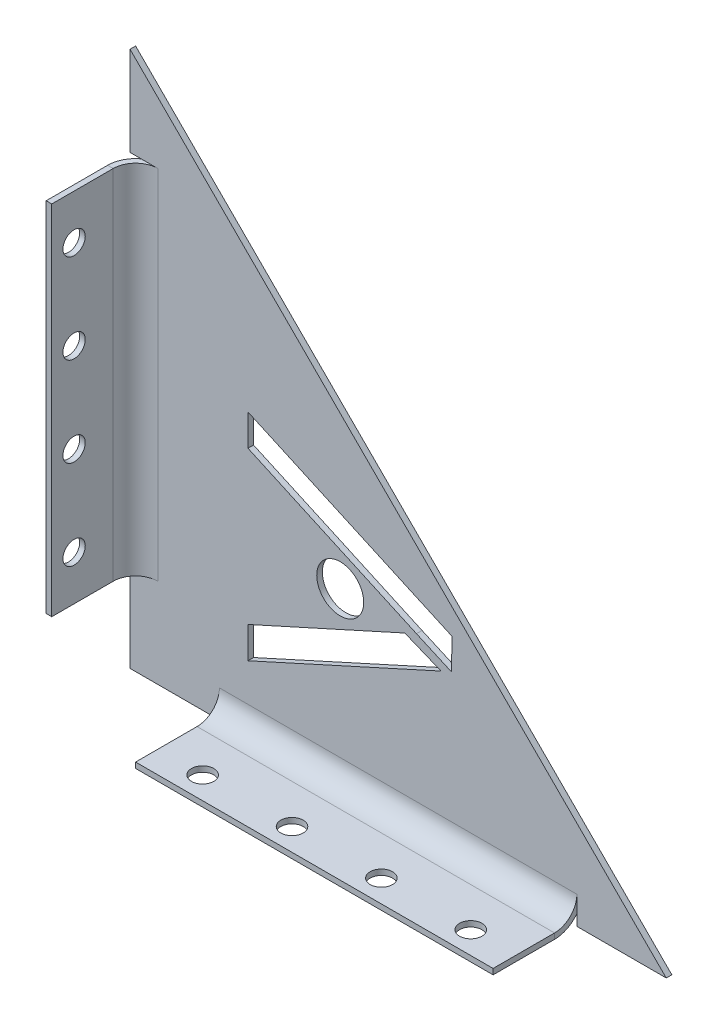
from build123d import *

# Parameters (mm, degrees)
BOSS_EXTRUDE1_DEPTH          = 1.5875
SKETCH7_W                    = 1.5875
SKETCH7_H                    = 101.6
BOSS_EXTRUDE2_DEPTH          = 0.0254
EDGE_FLANGE1_STRIP_W         = 19.05
EDGE_FLANGE1_STRIP_H         = 1.5875
EDGE_FLANGE1_STRIP_CUT_DEPTH = 101.6
EDGE_FLANGE1_DEPTH           = 101.6
SKETCH11_W                   = 101.6
SKETCH11_H                   = 1.5875
BOSS_EXTRUDE3_DEPTH          = 0.0254
EDGE_FLANGE2_STRIP_W         = 19.05
EDGE_FLANGE2_STRIP_H         = 1.5875
EDGE_FLANGE2_STRIP_CUT_DEPTH = 101.6
EDGE_FLANGE2_DEPTH           = 101.6
SKETCH15_R                   = 3.175
CUT_EXTRUDE1_DEPTH           = 2.54
SKETCH16_R                   = 3.175
CUT_EXTRUDE2_DEPTH           = 2.54
SKETCH18_R                   = 6.676012736
CUT_EXTRUDE5_DEPTH           = 2.54


# Sheet-metal steps are written as plain solids
with BuildPart() as part:
    # Sketch1 → Boss-Extrude1 (new body)
    with BuildSketch(Plane.XY):
        Polygon((0, 119.481843199), (0, -32.918156801), (152.4, -32.918156801), align=None)
    extrude(amount=BOSS_EXTRUDE1_DEPTH)

    # Sketch7 → Boss-Extrude2 (add)
    with BuildSketch(Plane.ZY):
        with Locations((0.79375, 43.281843199)):
            Rectangle(SKETCH7_W, SKETCH7_H)
    extrude(amount=BOSS_EXTRUDE2_DEPTH)

    # Edge-Flange1 strip (across the edge) → Edge-Flange1 strip cut (cut)
    with BuildSketch(Plane(origin=(-0.0254, 94.081843199, 1.5875), x_dir=(1, 0, 0), z_dir=(0, -1, 0))):
        with Locations((-1.5875, -0.79375)):
            Rectangle(EDGE_FLANGE1_STRIP_W, EDGE_FLANGE1_STRIP_H)
    extrude(amount=EDGE_FLANGE1_STRIP_CUT_DEPTH, mode=Mode.SUBTRACT)

    # Edge-Flange1 section (across the edge) → Edge-Flange1 (add)
    with BuildSketch(Plane(origin=(-0.0254, 94.081843199, 1.5875), x_dir=(1, 0, 0), z_dir=(0, -1, 0))):
        with BuildLine():
            Line((0, 6.35), (0, 23.8125))
            Line((0, 23.8125), (1.5875, 23.8125))
            Line((1.5875, 23.8125), (1.5875, 6.35))
            ThreePointArc((1.5875, 6.35), (3.447371939, 1.859871939), (7.9375, 0))
            Line((7.9375, 0), (7.9375, -1.5875))
            ThreePointArc((7.9375, -1.5875), (2.324839924, 0.737339924), (0, 6.35))
        make_face()
    extrude(amount=EDGE_FLANGE1_DEPTH)

    # Sketch11 → Boss-Extrude3 (add)
    with BuildSketch(Plane(origin=(0, -32.918156801, 0), x_dir=(-1, 0, 0), z_dir=(0, -1, 0))):
        with Locations((-76.2, -0.79375)):
            Rectangle(SKETCH11_W, SKETCH11_H)
    extrude(amount=BOSS_EXTRUDE3_DEPTH)

    # Edge-Flange2 strip (across the edge) → Edge-Flange2 strip cut (cut)
    with BuildSketch(Plane(origin=(25.4, -32.943556801, 1.5875), x_dir=(0, 1, 0), z_dir=(1, 0, 0))):
        with Locations((-1.5875, -0.79375)):
            Rectangle(EDGE_FLANGE2_STRIP_W, EDGE_FLANGE2_STRIP_H)
    extrude(amount=EDGE_FLANGE2_STRIP_CUT_DEPTH, mode=Mode.SUBTRACT)

    # Edge-Flange2 section (across the edge) → Edge-Flange2 (add)
    with BuildSketch(Plane(origin=(25.4, -32.943556801, 1.5875), x_dir=(0, 1, 0), z_dir=(1, 0, 0))):
        with BuildLine():
            Line((0, 6.35), (0, 23.8125))
            Line((0, 23.8125), (1.5875, 23.8125))
            Line((1.5875, 23.8125), (1.5875, 6.35))
            ThreePointArc((1.5875, 6.35), (3.447371939, 1.859871939), (7.9375, 0))
            Line((7.9375, 0), (7.9375, -1.5875))
            ThreePointArc((7.9375, -1.5875), (2.324839924, 0.737339924), (0, 6.35))
        make_face()
    extrude(amount=EDGE_FLANGE2_DEPTH)

    # Sketch15 → Cut-Extrude1 (cut)
    with BuildSketch(Plane(origin=(0, -31.356056801, 0), x_dir=(1, 0, 0), z_dir=(0, 1, 0))):
        with Locations(Location((38.1, -19.05, 0), (0, 0, 270))):
            Circle(SKETCH15_R)
        with Locations(Location((63.5, -19.05, 0), (0, 0, 270))):
            Circle(SKETCH15_R)
        with Locations(Location((88.9, -19.05, 0), (0, 0, 270))):
            Circle(SKETCH15_R)
        with Locations(Location((114.3, -19.05, 0), (0, 0, 270))):
            Circle(SKETCH15_R)
    extrude(amount=-CUT_EXTRUDE1_DEPTH, mode=Mode.SUBTRACT)

    # Sketch16 → Cut-Extrude2 (cut)
    with BuildSketch(Plane(origin=(1.5621, 0, 0), x_dir=(0, 0, -1), z_dir=(1, 0, 0))):
        with Locations((-19.05, 81.381843199)):
            Circle(SKETCH16_R)
        with Locations((-19.05, 55.981843199)):
            Circle(SKETCH16_R)
        with Locations((-19.05, 30.581843199)):
            Circle(SKETCH16_R)
        with Locations((-19.05, 5.181843199)):
            Circle(SKETCH16_R)
    extrude(amount=-CUT_EXTRUDE2_DEPTH, mode=Mode.SUBTRACT)

    # Sketch18 → Cut-Extrude5 (cut)
    with BuildSketch(Plane(origin=(0, 0, 0), x_dir=(-1, 0, 0), z_dir=(0, 0, -1))):
        with Locations((-59.739888133, 16.534721244)):
            Circle(SKETCH18_R)
        with BuildLine():
            Line((-88.393458916, 10.622584789), (-78.10421078, 14.837125247))
            Line((-78.10421078, 14.837125247), (-33.528048288, -5.335200069))
            add(Edge.make_bspline(
                [(-33.528048288, -5.335200069), (-33.513417888, -8.314924869), (-33.518294688, -11.294649669), (-33.528048288, -14.269497669)],
                knots=[0, 0, 0, 0, 1, 1, 1, 1], degree=3))
            Line((-33.528048288, -14.269497669), (-88.393458916, 10.622584789))
        make_face()
        with BuildLine():
            Line((-91.576598688, 20.702035131), (-91.293744288, 11.938425531))
            Line((-91.293744288, 11.938425531), (-81.408470688, 16.332422331))
            Line((-81.408470688, 16.332422331), (-33.513417888, 38.024428731))
            add(Edge.make_bspline(
                [(-33.532925088, 46.958726331), (-33.503664288, 43.979001531), (-33.532925088, 40.999276731), (-33.513417888, 38.024428731)],
                knots=[0, 0, 0, 0, 1, 1, 1, 1], degree=3))
            Line((-33.532925088, 46.958726331), (-91.576598688, 20.702035131))
        make_face()
    extrude(amount=-CUT_EXTRUDE5_DEPTH, mode=Mode.SUBTRACT)


solid = part.part
